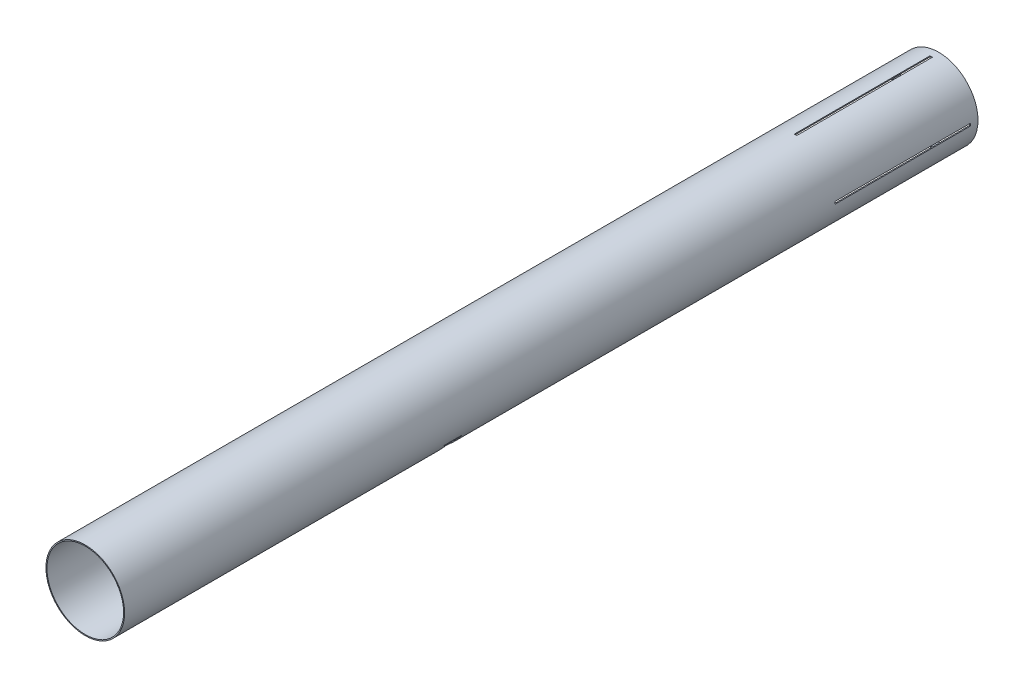
from build123d import *

# Parameters (mm, degrees)
SKETCH1_R               = 78.35
SKETCH1_R_2             = 76.35
BOSS_EXTRUDE1_DEPTH     = 1700
SKETCH5_R               = 15
CUT_EXTRUDE2_DEPTH      = 1704.607186237
SKETCH6_W               = 4.8
SKETCH6_H               = 270
CUT_EXTRUDE3_DEPTH      = 1704.607186346
CIRPATTERN1_COUNT       = 2
CIRPATTERN1_ANGLE       = 90
CUT_EXTRUDE4_DEPTH      = 17.5
CUT_EXTRUDE4_DEPTH_BACK = 17.5


with BuildPart() as part:
    # Sketch1 → Boss-Extrude1 (new body)
    with BuildSketch(Plane.XY):
        Circle(SKETCH1_R)
        Circle(SKETCH1_R_2, mode=Mode.SUBTRACT)
    extrude(amount=BOSS_EXTRUDE1_DEPTH)

    # Sketch5 → Cut-Extrude2 (cut, through all)
    with BuildSketch(Plane(origin=(0, 0, 0), x_dir=(0, 0, -1), z_dir=(0.7071067811865489, -0.7071067811865462, 0))):
        with Locations((-1034.89, 0)):
            Circle(SKETCH5_R)
    extrude(amount=CUT_EXTRUDE2_DEPTH, mode=Mode.SUBTRACT)

    # Sketch6 → Cut-Extrude3 (cut, symmetric)
    with BuildSketch(Plane(origin=(0, 0, 0), x_dir=(1, 0, 0), z_dir=(0, 1, 0))):
        with Locations((0, -150)):
            Rectangle(SKETCH6_W, SKETCH6_H)
    cut_extrude3 = extrude(amount=CUT_EXTRUDE3_DEPTH, both=True, mode=Mode.SUBTRACT)

    # CirPattern1: Cut-Extrude3 ×2 about axis
    cirpattern1_axis = Axis((0, 0, 0), (0, 0, 1))
    for i in range(1, CIRPATTERN1_COUNT):
        add(cut_extrude3.rotate(cirpattern1_axis, i * CIRPATTERN1_ANGLE / (CIRPATTERN1_COUNT - 1)), mode=Mode.SUBTRACT)

    # Sketch7 → Cut-Extrude4 (cut, two sides: drawn at the far end of the back side and taken through both)
    with BuildSketch(Plane.XY.offset(1035).offset(-CUT_EXTRUDE4_DEPTH_BACK)):
        with BuildLine():
            Line((39.750148299, -65.186257833), (40.791409551, -66.893821889))
            ThreePointArc((40.791409551, -66.893821889), (42.064606356, -66.100615671), (43.322383986, -65.283179654))
            Line((43.322383986, -65.283179654), (42.216515856, -63.616729631))
            ThreePointArc((42.216515856, -63.616729631), (40.990844866, -64.413299381), (39.750148299, -65.186257833))
        make_face()
        with BuildLine():
            Line((63.766095032, -41.990565897), (65.436457705, -43.090515233))
            ThreePointArc((65.436457705, -43.090515233), (66.249426533, -41.829845613), (67.038111015, -40.553842871))
            Line((67.038111015, -40.553842871), (65.326863765, -39.518645861))
            ThreePointArc((65.326863765, -39.518645861), (64.558311625, -40.76207674), (63.766095032, -41.990565897))
        make_face()
    extrude(amount=CUT_EXTRUDE4_DEPTH + CUT_EXTRUDE4_DEPTH_BACK, mode=Mode.SUBTRACT)


solid = part.part
